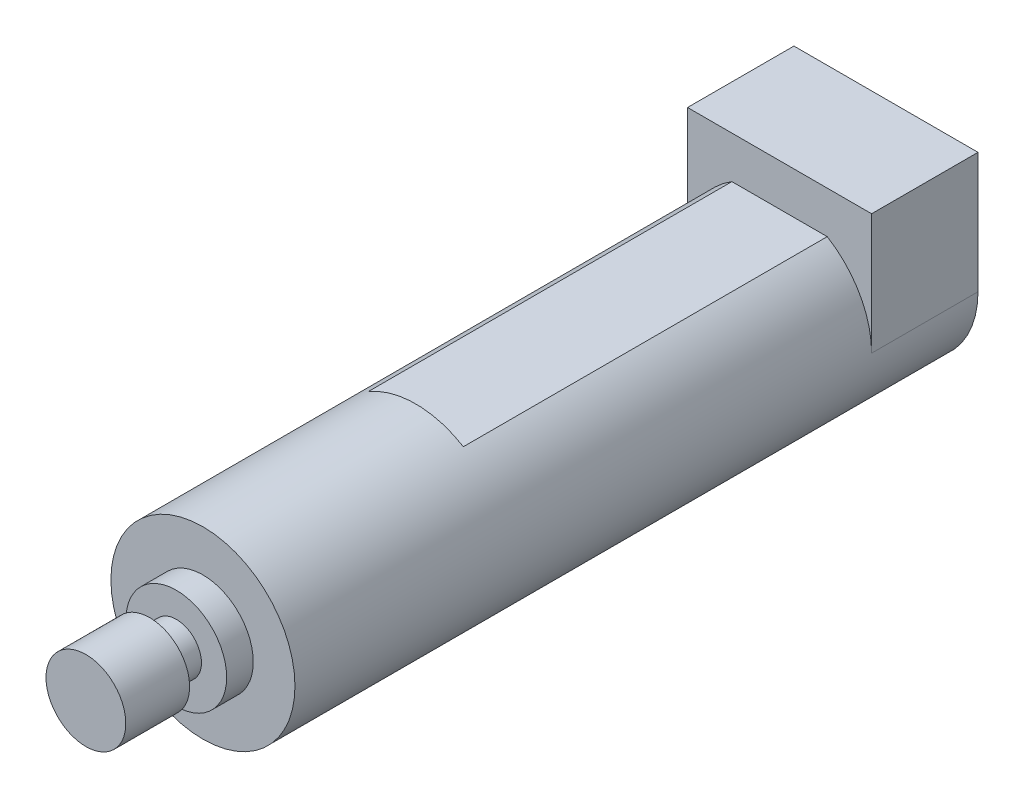
from build123d import *
from build123d.topology import SkipClean

# Parameters (mm, degrees)
BOSS_EXTRUDE1_DEPTH = 12.7
BOSS_EXTRUDE2_DEPTH = 43.434
SKETCH3_R           = 10.9855
BOSS_EXTRUDE3_DEPTH = 25.4
SKETCH4_R           = 6.0071
BOSS_EXTRUDE4_DEPTH = 3.175
SKETCH5_R           = 2.9972
BOSS_EXTRUDE5_DEPTH = 3.175
SKETCH6_R           = 4.7625
BOSS_EXTRUDE6_DEPTH = 7.62


with BuildPart() as part:
    # Sketch1 → Boss-Extrude1 (new body)
    with BuildSketch(Plane.XY):
        with BuildLine():
            Line((-10.9855, 0), (-10.9855, 14.4145))
            Line((-10.9855, 14.4145), (10.9855, 14.4145))
            Line((10.9855, 14.4145), (10.9855, 0))
            ThreePointArc((10.9855, 0), (0, -10.9855), (-10.9855, 0))
        make_face()
    extrude(amount=BOSS_EXTRUDE1_DEPTH)

    # Sketch2 → Boss-Extrude2 (add)
    with BuildSketch(Plane.XY.offset(12.7)):
        with BuildLine():
            Line((-5.68848, 9.398), (5.68848, 9.398))
            ThreePointArc((5.68848, 9.398), (10.9855, 0), (5.68848, -9.398))
            Line((5.68848, -9.398), (-5.68848, -9.398))
            ThreePointArc((-5.68848, -9.398), (-10.9855, 0), (-5.68848, 9.398))
        make_face()
    extrude(amount=BOSS_EXTRUDE2_DEPTH)

    # Sketch3 → Boss-Extrude3 (add)
    with BuildSketch(Plane.XY.offset(56.134)):
        Circle(SKETCH3_R)
    extrude(amount=BOSS_EXTRUDE3_DEPTH)

    # Sketch4 → Boss-Extrude4 (add)
    with BuildSketch(Plane.XY.offset(81.534)):
        Circle(SKETCH4_R)
    extrude(amount=BOSS_EXTRUDE4_DEPTH)

    # Sketch5 → Boss-Extrude5 (add)
    with BuildSketch(Plane.XY.offset(84.709)):
        Circle(SKETCH5_R)
    extrude(amount=BOSS_EXTRUDE5_DEPTH)

    # Sketch6 → Boss-Extrude6 (add)
    with SkipClean():  # the faces are left unmerged after this step: merging them gives an invalid solid
        with BuildSketch(Plane.XY.offset(87.884)):
            Circle(SKETCH6_R)
        extrude(amount=BOSS_EXTRUDE6_DEPTH)


solid = part.part
